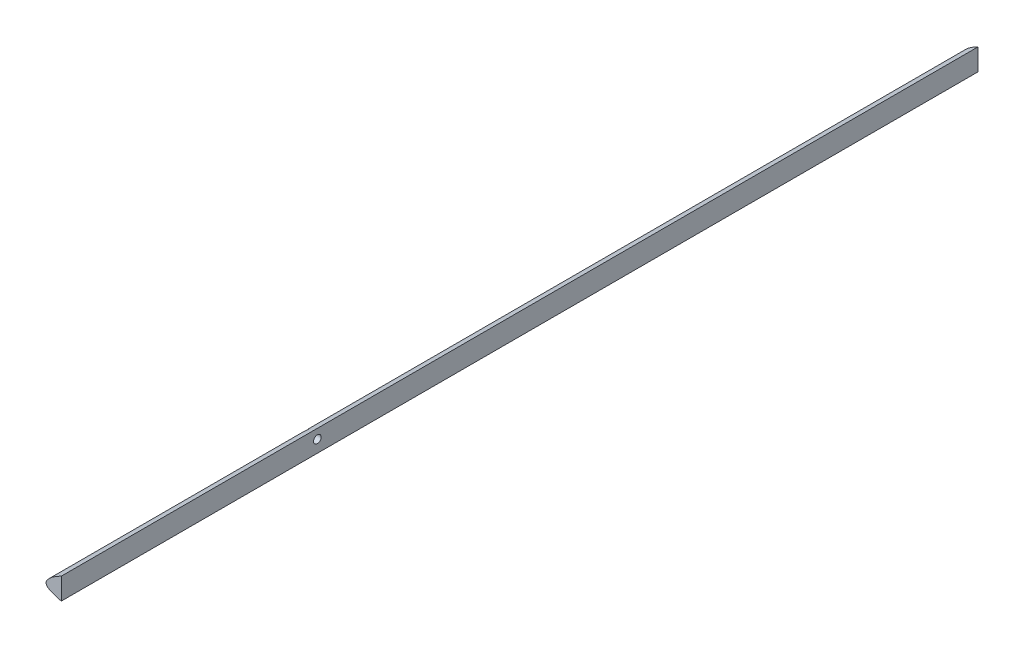
from build123d import *

# Parameters (mm, degrees)
BOSS_EXTRUDE2_DEPTH = 761.999746
CUT_EXTRUDE1_START  = -761.999746
CUT_EXTRUDE1_DEPTH  = 761.999746
SKETCH3_R           = 3.175
CUT_EXTRUDE2_DEPTH  = 763.18665214


# Read off the part's stored shape, not the designer's step: Cut-Extrude1
with BuildPart() as part:
    # Sketch2 → Boss-Extrude2 (new body)
    with BuildSketch(Plane.XY):
        with BuildLine():
            add(Edge.make_bspline(
                [(324.902693551, 0), (324.903463196, 0.023313358), (322.493960125, 0.266874853), (320.107118726, 0.728898482), (314.479929879, 1.696599545), (307.761979309, 2.966510847), (299.156213966, 4.44402059), (289.108994082, 6.054587212), (277.614504557, 7.858625418), (264.867967682, 9.828639283), (251.037893607, 11.946456865), (236.320520328, 14.162828682), (220.915494029, 16.434797842), (205.033677241, 18.716292105), (188.883341887, 20.922988597), (172.682407247, 22.997310524), (156.622614565, 24.830178487), (140.850407651, 26.262579625), (125.478771128, 27.205045845), (110.596641232, 27.609413226), (96.285303339, 27.444653165), (82.616452357, 26.722177249), (69.668434964, 25.464252485), (57.528852266, 23.789075325), (46.305668853, 21.755773795), (36.112498821, 19.421560607), (27.045487678, 16.846978605), (19.196955025, 14.082419467), (12.619518254, 11.195340149), (7.393829249, 8.273577005), (3.466455599, 5.362609604), (1.07214418, 2.697450283), (-0.443018312, -0.016380309), (1.142123289, -2.660381571), (4.36503606, -4.226764571), (8.971221404, -6.028809419), (15.243598774, -7.49562747), (23.03205608, -8.813433078), (32.324829104, -9.885015211), (43.025610851, -10.722004925), (55.037019029, -11.32133074), (68.234402161, -11.683120574), (82.476890937, -11.821694636), (97.60585357, -11.731263556), (113.468681032, -11.414630367), (129.930020513, -10.79847052), (146.859715047, -9.938801137), (164.102555428, -8.954688629), (181.455347718, -7.914187903), (198.694582839, -6.86098311), (215.596359861, -5.836960409), (231.942646987, -4.863457625), (247.517899408, -3.967162621), (262.118380872, -3.157120583), (275.542852028, -2.445675428), (287.622696903, -1.835678138), (298.158964313, -1.306811978), (307.16541669, -0.826816664), (314.173983408, -0.368946975), (319.99978897, -0.117218531), (322.45689994, 0.039112512), (324.901921434, -0.023388259), (324.902693551, 0)],
                knots=[0, 0, 0, 0, 0.001748082, 0.006827365, 0.014880219, 0.025572325, 0.038694157, 0.05417078, 0.071834092, 0.091434533, 0.112684614, 0.135293129, 0.158943981, 0.183314993, 0.208069947, 0.232879416, 0.257398767, 0.281383633, 0.304705763, 0.327241497, 0.348896563, 0.36960694, 0.389308376, 0.407885696, 0.425177149, 0.44102679, 0.455299972, 0.467903885, 0.478751648, 0.487814349, 0.495090031, 0.500616983, 0.504451368, 0.507803776, 0.513091193, 0.520546229, 0.530249123, 0.542213645, 0.556382479, 0.572655502, 0.590894529, 0.610925387, 0.632535859, 0.655496365, 0.679547083, 0.704498569, 0.730211425, 0.756435525, 0.782836661, 0.80906245, 0.834775916, 0.859641281, 0.883337827, 0.905540839, 0.925965139, 0.944326313, 0.960365877, 0.973929438, 0.984907697, 0.99311134, 0.998246302, 1, 1, 1, 1], degree=3))
        make_face()
    extrude(amount=-BOSS_EXTRUDE2_DEPTH)

    # Cut-Extrude1 outline → Cut-Extrude1 (cut)
    with BuildSketch(Plane.XY.offset(CUT_EXTRUDE1_START)):
        with BuildLine():
            add(Edge.make_bspline(
                [(324.902693551, 0), (324.903463196, 0.023313358), (322.493960125, 0.266874853), (320.107118726, 0.728898482), (314.479929879, 1.696599545), (307.761979309, 2.966510847), (299.156213966, 4.44402059), (289.108994082, 6.054587212), (277.614504557, 7.858625418), (264.867967682, 9.828639283), (251.037893607, 11.946456865), (236.320520328, 14.162828682), (220.915494029, 16.434797842), (205.033677241, 18.716292105), (188.883341887, 20.922988597), (172.682407247, 22.997310524), (156.622614565, 24.830178487), (140.850407651, 26.262579625), (125.478771128, 27.205045845), (110.596641232, 27.609413226), (96.285303339, 27.444653165), (82.616452357, 26.722177249), (69.668434964, 25.464252485), (57.528852266, 23.789075325), (46.305668853, 21.755773795), (36.112498821, 19.421560607), (27.045487678, 16.846978605), (19.3313577, 14.129761328), (14.714314762, 12.114502523), (12.7, 11.117087729)],
                knots=[0, 0, 0, 0, 0.001748082, 0.006827365, 0.014880219, 0.025572325, 0.038694157, 0.05417078, 0.071834092, 0.091434533, 0.112684614, 0.135293129, 0.158943981, 0.183314993, 0.208069947, 0.232879416, 0.257398767, 0.281383633, 0.304705763, 0.327241497, 0.348896563, 0.36960694, 0.389308376, 0.407885696, 0.425177149, 0.44102679, 0.455299972, 0.467903885, 0.478105627, 0.478105627, 0.478105627, 0.478105627], degree=3))
            Line((12.7, 11.117087729), (12.7, -6.876035615))
            add(Edge.make_bspline(
                [(12.7, -6.876035615), (13.386291094, -7.033779246), (16.659123202, -7.735133954), (23.03205608, -8.813433078), (32.324829104, -9.885015211), (43.025610851, -10.722004925), (55.037019029, -11.32133074), (68.234402161, -11.683120574), (82.476890937, -11.821694636), (97.60585357, -11.731263556), (113.468681032, -11.414630367), (129.930020513, -10.79847052), (146.859715047, -9.938801137), (164.102555428, -8.954688629), (181.455347718, -7.914187903), (198.694582839, -6.86098311), (215.596359861, -5.836960409), (231.942646987, -4.863457625), (247.517899408, -3.967162621), (262.118380872, -3.157120583), (275.542852028, -2.445675428), (287.622696903, -1.835678138), (298.158964313, -1.306811978), (307.16541669, -0.826816664), (314.173983408, -0.368946975), (319.99978897, -0.117218531), (322.45689994, 0.039112512), (324.901921434, -0.023388259), (324.902693551, 0)],
                knots=[0.52705934, 0.52705934, 0.52705934, 0.52705934, 0.530249123, 0.542213645, 0.556382479, 0.572655502, 0.590894529, 0.610925387, 0.632535859, 0.655496365, 0.679547083, 0.704498569, 0.730211425, 0.756435525, 0.782836661, 0.80906245, 0.834775916, 0.859641281, 0.883337827, 0.905540839, 0.925965139, 0.944326313, 0.960365877, 0.973929438, 0.984907697, 0.99311134, 0.998246302, 1, 1, 1, 1], degree=3))
        make_face()
    extrude(amount=CUT_EXTRUDE1_DEPTH, mode=Mode.SUBTRACT)

    # Sketch3 → Cut-Extrude2 (cut, through all)
    with BuildSketch(Plane.ZY):
        with Locations(Location((-212.852, 3.243087729, 0), (0, 0, 270))):
            Circle(SKETCH3_R)
    extrude(amount=-CUT_EXTRUDE2_DEPTH, mode=Mode.SUBTRACT)


solid = part.part
